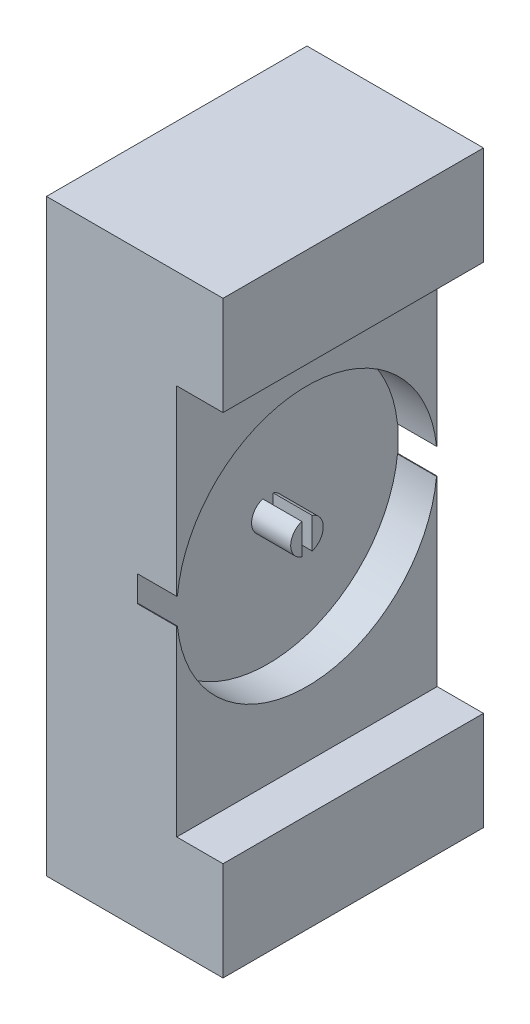
from build123d import *

# Parameters (mm, degrees)
SKETCH1_W           = 100
SKETCH1_H           = 100
BOSS_EXTRUDE1_DEPTH = 226
SKETCH5_W           = 35.1
SKETCH5_H           = 150
CUT_EXTRUDE1_DEPTH  = 253.142816673
BOSS_EXTRUDE2_DEPTH = 15
SKETCH8_W           = 32.221965863
SKETCH8_H           = 226
CUT_EXTRUDE3_DEPTH  = 253.142816673


with BuildPart() as part:
    # Sketch1 → Boss-Extrude1 (new body)
    with BuildSketch(Plane(origin=(0, 0, 0), x_dir=(1, 0, 0), z_dir=(0, 1, 0))):
        Rectangle(SKETCH1_W, SKETCH1_H)
    extrude(amount=BOSS_EXTRUDE1_DEPTH)

    # Sketch5 → Cut-Extrude1 (cut, through all)
    with BuildSketch(Plane(origin=(0, 0, -50), x_dir=(-1, 0, 0), z_dir=(0, 0, -1))):
        with Locations((-2.55, 113)):
            Rectangle(SKETCH5_W, SKETCH5_H)
    extrude(amount=-CUT_EXTRUDE1_DEPTH, mode=Mode.SUBTRACT)

    # Sketch6 → Boss-Extrude2 (add)
    with BuildSketch(Plane(origin=(-15, 0, 0), x_dir=(0, 0, -1), z_dir=(1, 0, 0))):
        with BuildLine():
            ThreePointArc((-2, 118.921359641), (-6.25, 113), (-2, 107.078640359))
            Line((-2, 107.078640359), (-2, 118.921359641))
        make_face()
        with BuildLine():
            Line((2, 118.921359641), (2, 107.078640359))
            ThreePointArc((2, 107.078640359), (6.25, 113), (2, 118.921359641))
        make_face()
        with BuildLine():
            Line((-50, 118), (-49.749371855, 118))
            ThreePointArc((-49.749371855, 118), (0, 163), (49.749371855, 118))
            Line((49.749371855, 118), (50, 118))
            Line((50, 118), (50, 188))
            Line((50, 188), (-50, 188))
            Line((-50, 188), (-50, 118))
        make_face()
        with BuildLine():
            ThreePointArc((49.749371855, 108), (0, 63), (-49.749371855, 108))
            Line((-49.749371855, 108), (-50, 108))
            Line((-50, 108), (-50, 38))
            Line((-50, 38), (50, 38))
            Line((50, 38), (50, 108))
            Line((50, 108), (49.749371855, 108))
        make_face()
    extrude(amount=BOSS_EXTRUDE2_DEPTH)

    # Sketch8 → Cut-Extrude3 (cut, through all)
    with BuildSketch(Plane.XY.offset(50)):
        with Locations((33.889017069, 113)):
            Rectangle(SKETCH8_W, SKETCH8_H)
    extrude(amount=-CUT_EXTRUDE3_DEPTH, mode=Mode.SUBTRACT)


solid = part.part
